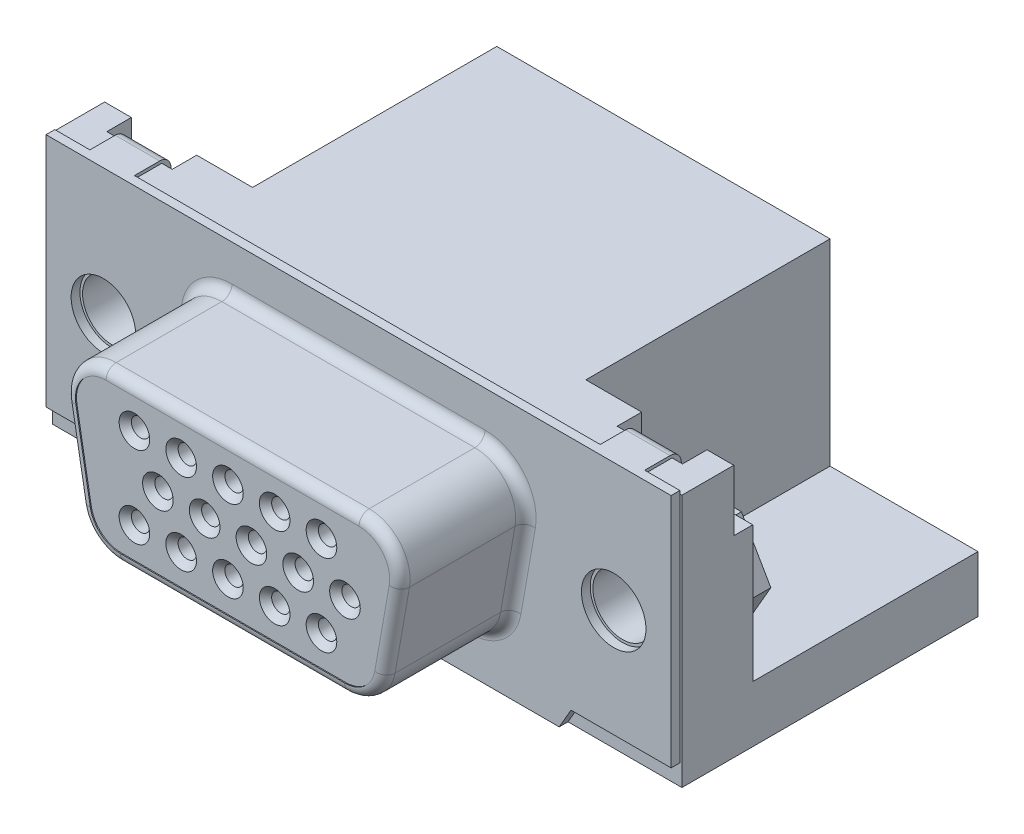
from build123d import *
from build123d.topology import SkipClean

# Parameters (mm, degrees)
SKETCH1_R                 = 1.58
BASE_EXTRUDE_DEPTH        = 0.43
ENGAGEMENT_D_DEPTH        = 6.17
ENGAGEMENT_RADII_R        = 0.5
TOP_START                 = -2.54
TOP_CUT_OUT_OUTLINE_W     = 30.81
TOP_CUT_OUT_OUTLINE_H     = 2.76
TOP_CUT_OUT_DEPTH         = 14.5
TOP_CUT_OUT_2_OUTLINE_W   = 30.81
TOP_CUT_OUT_2_OUTLINE_H   = 6.65
TOP_CUT_OUT_2_DEPTH       = 3.47
TOP_CUT_OUT_3_OUTLINE_W   = 1.31
TOP_CUT_OUT_3_OUTLINE_H   = 2.99
TOP_CUT_OUT_3_OUTLINE_W_2 = 21.79
TOP_CUT_OUT_3_DEPTH       = 2.54
TOP_CUT_OUT_4_OUTLINE_W   = 3.2
TOP_CUT_OUT_4_OUTLINE_H   = 2.99
TOP_CUT_OUT_4_DEPTH       = 1.34
TAB_TOP_DEPTH             = 1.09
SKETCH15_R                = 1.45
NUT_DEPTH                 = 0.91
NUT_HOLE_REACH            = 32.65
SKETCH16_R                = 1.45
CUT_EXTRUDE9_DEPTH        = 0.05
SKETCH20_W                = 16.32
SKETCH20_H                = 11.96
BOSS_EXTRUDE1_DEPTH       = 9.64
SKETCH25_W                = 0.43
SKETCH25_H                = 11.55
CUT_EXTRUDE13_DEPTH       = 0.1
SKETCH26_W                = 0.43
SKETCH26_H                = 11.55
CUT_EXTRUDE14_DEPTH       = 0.1
SKETCH30_R                = 0.45
CUT_EXTRUDE16_DEPTH       = 6
LPATTERN1_COUNT           = 5
LPATTERN1_PITCH           = 2.29
CHAMFER1_SIZE             = 0.3


# Read off the part's stored shape, not the designer's step: top cut out
with BuildPart() as part:
    # Sketch1 → Base-Extrude (new body)
    with BuildSketch(Plane.XY):
        Polygon((-2.91, 6.275), (27.9, 6.275), (27.9, -5.275), (22.9, -5.275), (22.322649731, -6.275), (2.667350269, -6.275), (2.09, -5.275), (-2.91, -5.275), align=None)
        Circle(SKETCH1_R, mode=Mode.SUBTRACT)
        with Locations((24.99, 0)):
            Circle(SKETCH1_R, mode=Mode.SUBTRACT)
    extrude(amount=BASE_EXTRUDE_DEPTH)

    # Sketch2 → engagement D (add)
    with BuildSketch(Plane.XY.offset(0.43)):
        with BuildLine():
            Line((6.3, 4), (18.69, 4))
            ThreePointArc((18.69, 4), (20.222088886, 3.285575219), (20.659615506, 1.652703645))
            Line((20.659615506, 1.652703645), (19.954307583, -2.347296355))
            ThreePointArc((19.954307583, -2.347296355), (19.270267297, -3.532088886), (17.984692077, -4))
            Line((17.984692077, -4), (7.005307923, -4))
            ThreePointArc((7.005307923, -4), (5.719732703, -3.532088886), (5.035692417, -2.347296355))
            Line((5.035692417, -2.347296355), (4.330384494, 1.652703645))
            ThreePointArc((4.330384494, 1.652703645), (4.767911114, 3.285575219), (6.3, 4))
        make_face()
    extrude(amount=ENGAGEMENT_D_DEPTH)

    # engagement radii
    engagement_radii_edges = [part.edges().sort_by_distance(p)[0] for p in [
        (20.222088886, 3.285575219, 0.43),
        (12.495, 4, 6.6),
        (4.767911114, 3.285575219, 6.6),
        (4.683038455, -0.347296355, 0.43),
        (5.719732703, -3.532088886, 6.6),
        (12.495, -4, 0.43),
        (19.270267297, -3.532088886, 0.43),
        (20.306961545, -0.347296355, 6.6),
        (20.222088886, 3.285575219, 6.6),
        (4.683038455, -0.347296355, 6.6),
        (12.495, -4, 6.6),
        (19.270267297, -3.532088886, 6.6),
        (20.306961545, -0.347296355, 0.43),
        (5.719732703, -3.532088886, 0.43),
        (4.767911114, 3.285575219, 0.43),
        (12.495, 4, 0.43),
    ]]
    fillet(engagement_radii_edges, radius=ENGAGEMENT_RADII_R)

    # top cut out outline → top cut out (add)
    with BuildSketch(Plane(origin=(0, 0, -2.54), x_dir=(-1, 0, 0), z_dir=(0, 0, -1)).offset(TOP_START)):
        with Locations((-12.495, -4.895)):
            Rectangle(TOP_CUT_OUT_OUTLINE_W, TOP_CUT_OUT_OUTLINE_H)
    extrude(amount=TOP_CUT_OUT_DEPTH)

    # top cut out 2 outline → top cut out 2 (add)
    with BuildSketch(Plane(origin=(0, 0, -2.54), x_dir=(-1, 0, 0), z_dir=(0, 0, -1)).offset(TOP_START)):
        with Locations((-12.495, -0.19)):
            Rectangle(TOP_CUT_OUT_2_OUTLINE_W, TOP_CUT_OUT_2_OUTLINE_H)
    extrude(amount=TOP_CUT_OUT_2_DEPTH)

    # top cut out 3 outline → top cut out 3 (add)
    with BuildSketch(Plane(origin=(0, 0, -2.54), x_dir=(-1, 0, 0), z_dir=(0, 0, -1)).offset(TOP_START)):
        with Locations((-27.245, 4.63)):
            Rectangle(TOP_CUT_OUT_3_OUTLINE_W, TOP_CUT_OUT_3_OUTLINE_H)
        with Locations((-12.495, 4.63)):
            Rectangle(TOP_CUT_OUT_3_OUTLINE_W_2, TOP_CUT_OUT_3_OUTLINE_H)
        with Locations((2.255, 4.63)):
            Rectangle(TOP_CUT_OUT_3_OUTLINE_W, TOP_CUT_OUT_3_OUTLINE_H)
    extrude(amount=TOP_CUT_OUT_3_DEPTH)

    # top cut out 4 outline → top cut out 4 (add)
    with BuildSketch(Plane(origin=(0, 0, -2.54), x_dir=(-1, 0, 0), z_dir=(0, 0, -1)).offset(TOP_START)):
        with Locations((-24.99, 4.63)):
            Rectangle(TOP_CUT_OUT_4_OUTLINE_W, TOP_CUT_OUT_4_OUTLINE_H)
        with Locations((0, 4.63)):
            Rectangle(TOP_CUT_OUT_4_OUTLINE_W, TOP_CUT_OUT_4_OUTLINE_H)
    extrude(amount=TOP_CUT_OUT_4_DEPTH)

    # Sketch14 → tab top (add, symmetric)
    with BuildSketch(Plane(origin=(0, 0, 0), x_dir=(0, 0, -1), z_dir=(1, 0, 0))):
        with BuildLine():
            Line((1.34, 5.725), (1.34, 4.335))
            Line((1.34, 4.335), (1.79, 4.335))
            Line((1.79, 4.335), (1.79, 5.725))
            ThreePointArc((1.79, 5.725), (1.62890873, 6.11390873), (1.24, 6.275))
            Line((1.24, 6.275), (0, 6.275))
            Line((0, 6.275), (0, 5.825))
            Line((0, 5.825), (1.24, 5.825))
            ThreePointArc((1.24, 5.825), (1.310710678, 5.795710678), (1.34, 5.725))
        make_face()
    tab_top = extrude(amount=TAB_TOP_DEPTH, both=True)

    # tab 2: tab top across plane
    add(tab_top.mirror(Plane(origin=(12.495, 0, 0), x_dir=(0, 0, 1), z_dir=(1, 0, 0))))

    # Sketch15 → nut (add)
    with BuildSketch(Plane(origin=(0, 0, -3.47), x_dir=(-1, 0, 0), z_dir=(0, 0, -1))):
        Polygon((2.886751346, 0), (1.443375673, 2.5), (-1.443375673, 2.5), (-2.886751346, 0), (-1.443375673, -2.5), (1.443375673, -2.5), align=None)
        with Locations(Location((0, 0, 0), (0, 0, 90))):
            Circle(SKETCH15_R, mode=Mode.SUBTRACT)
    nut = extrude(amount=NUT_DEPTH)

    # Sketch16 → nut hole (cut, up to next)
    with BuildSketch(Plane(origin=(0, 0, -3.47), x_dir=(-1, 0, 0), z_dir=(0, 0, -1)), mode=Mode.PRIVATE) as nut_hole_sk1:
        Circle(SKETCH16_R)
    nut_hole_tool1 = extrude(nut_hole_sk1.sketch, amount=-NUT_HOLE_REACH, mode=Mode.PRIVATE) & part.part
    nut_hole = nut_hole_tool1.solids().sort_by_distance((0, 0, -3.47))[0]
    add(nut_hole, mode=Mode.SUBTRACT)

    # nut 2: nut, nut hole across plane
    with SkipClean():  # the faces are left unmerged after this step: merging them gives an invalid solid
        add(nut.mirror(Plane(origin=(12.495, 0, 0), x_dir=(0, 0, 1), z_dir=(1, 0, 0))))
        add(nut_hole.mirror(Plane(origin=(12.495, 0, 0), x_dir=(0, 0, 1), z_dir=(1, 0, 0))), mode=Mode.SUBTRACT)

    # Sketch18 → Cut-Extrude9 (cut)
    with SkipClean():  # the faces are left unmerged after this step: merging them gives an invalid solid
        with BuildSketch(Plane.XY.offset(6.6)):
            with BuildLine():
                Line((19.461903707, -2.260472267), (20.16721163, 1.739527733))
                ThreePointArc((20.16721163, 1.739527733), (19.839066665, 2.964181415), (18.69, 3.5))
                Line((18.69, 3.5), (6.3, 3.5))
                ThreePointArc((6.3, 3.5), (5.150933335, 2.964181415), (4.82278837, 1.739527733))
                Line((4.82278837, 1.739527733), (5.528096293, -2.260472267))
                ThreePointArc((5.528096293, -2.260472267), (6.041126508, -3.149066665), (7.005307923, -3.5))
                Line((7.005307923, -3.5), (17.984692077, -3.5))
                ThreePointArc((17.984692077, -3.5), (18.948873492, -3.149066665), (19.461903707, -2.260472267))
            make_face()
        extrude(amount=-CUT_EXTRUDE9_DEPTH, mode=Mode.SUBTRACT)

    # Sketch20 → Boss-Extrude1 (add)
    with SkipClean():  # the faces are left unmerged after this step: merging them gives an invalid solid
        with BuildSketch(Plane(origin=(0, -3.515, 0), x_dir=(-1, 0, 0), z_dir=(0, 1, 0))):
            with Locations((-12.495, -8.52)):
                Rectangle(SKETCH20_W, SKETCH20_H)
        extrude(amount=BOSS_EXTRUDE1_DEPTH)

    # Sketch25 → Cut-Extrude13 (cut)
    with SkipClean():  # the faces are left unmerged after this step: merging them gives an invalid solid
        with BuildSketch(Plane(origin=(27.9, 0, 0), x_dir=(0, 0, -1), z_dir=(1, 0, 0))):
            with Locations((-0.215, 0.5)):
                Rectangle(SKETCH25_W, SKETCH25_H)
        extrude(amount=-CUT_EXTRUDE13_DEPTH, mode=Mode.SUBTRACT)

    # Sketch26 → Cut-Extrude14 (cut)
    with SkipClean():  # the faces are left unmerged after this step: merging them gives an invalid solid
        with BuildSketch(Plane.ZY.offset(2.91)):
            with Locations((0.215, 0.5)):
                Rectangle(SKETCH26_W, SKETCH26_H)
        extrude(amount=-CUT_EXTRUDE14_DEPTH, mode=Mode.SUBTRACT)

    # Sketch30 → Cut-Extrude16 (cut)
    with SkipClean():  # the faces are left unmerged after this step: merging them gives an invalid solid
        with BuildSketch(Plane.XY.offset(6.55)):
            with Locations((16.8, 2)):
                Circle(SKETCH30_R)
            with Locations(Location((16.8, -2, 0), (0, 0, 180))):
                Circle(SKETCH30_R)
            with Locations((17.95, 0)):
                Circle(SKETCH30_R)
        cut_extrude16 = extrude(amount=-CUT_EXTRUDE16_DEPTH, mode=Mode.SUBTRACT)

    # LPattern1: Cut-Extrude16 ×5
    with SkipClean():  # the faces are left unmerged after this step: merging them gives an invalid solid
        with Locations(*[(-i * LPATTERN1_PITCH, 0, 0) for i in range(1, LPATTERN1_COUNT)]):
            add(cut_extrude16, mode=Mode.SUBTRACT)

    # Chamfer1
    chamfer1_edges = [part.edges().sort_by_distance(p)[0] for p in [
        (16.35, 2, 6.55),
        (17.25, -2, 6.55),
        (17.5, 0, 6.55),
        (14.06, 2, 6.55),
        (14.96, -2, 6.55),
        (15.21, 0, 6.55),
        (11.77, 2, 6.55),
        (12.67, -2, 6.55),
        (12.92, 0, 6.55),
        (9.48, 2, 6.55),
        (10.38, -2, 6.55),
        (10.63, 0, 6.55),
        (7.19, 2, 6.55),
        (8.09, -2, 6.55),
        (8.34, 0, 6.55),
    ]]
    chamfer(chamfer1_edges, length=CHAMFER1_SIZE)


solid = part.part
